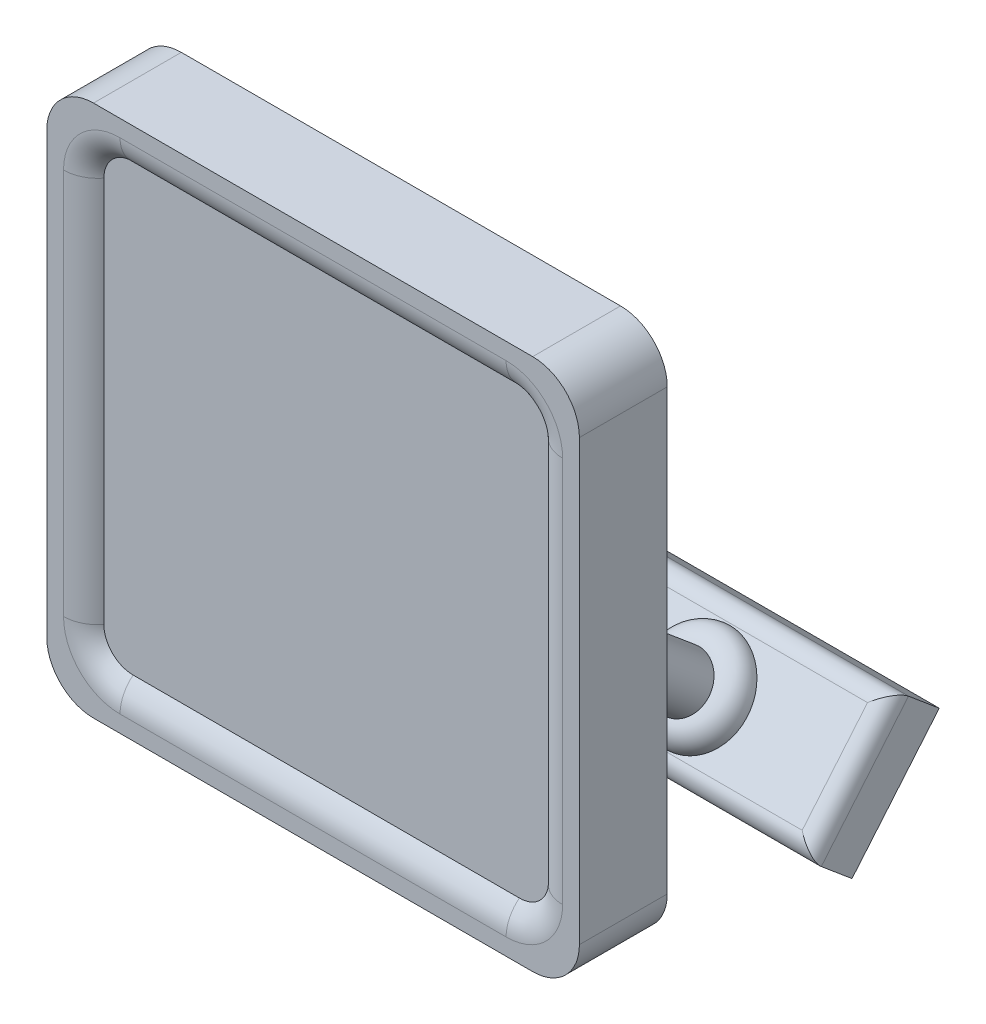
from build123d import *

# Parameters (mm, degrees)
BOSS_EXTRUDE1_DEPTH     = 25.4
CUT_EXTRUDE1_DEPTH      = 0.25399999999999945
CUT_EXTRUDE1_DEPTH_BACK = 3.8099999999999814
BOSS_EXTRUDE3_DEPTH     = 50.8
CUT_EXTRUDE3_DEPTH      = 38.1
SKETCH9_R               = 7.958201772862371
BOSS_EXTRUDE4_DEPTH     = 95.75799999999995
SKETCH11_W              = 88.91089611657237
SKETCH11_H              = 39.241441418777725
BOSS_EXTRUDE5_DEPTH     = 16.509999999999938
FILLET2_R               = 10
FILLET3_R               = 4.919999999999999


# Read off the part's stored shape, not the designer's step: Sweep1
with BuildPart() as part:
    # Sketch1 → Boss-Extrude1 (new body)
    with BuildSketch(Plane.XY):
        with BuildLine():
            Line((63.5, 77.01063829787236), (-63.5, 77.01063829787236))
            ThreePointArc((-63.5, 77.01063829787236), (-73.05346395858422, 73.05346395858422), (-77.01063829787236, 63.5))
            Line((-77.01063829787236, 63.5), (-77.01063829787236, -63.5))
            ThreePointArc((-77.01063829787236, -63.5), (-73.05346395858422, -73.05346395858422), (-63.5, -77.01063829787236))
            Line((-63.5, -77.01063829787236), (63.5, -77.01063829787236))
            ThreePointArc((63.5, -77.01063829787236), (73.05346395858422, -73.05346395858423), (77.01063829787236, -63.500000000000014))
            Line((77.01063829787236, -63.500000000000014), (77.01063829787236, 63.500000000000014))
            ThreePointArc((77.01063829787236, 63.500000000000014), (73.05346395858422, 73.05346395858423), (63.5, 77.01063829787236))
        make_face()
    extrude(amount=BOSS_EXTRUDE1_DEPTH)

    # Sketch3 → Cut-Extrude1 (cut, two sides: drawn at the far end of the back side and taken through both)
    with BuildSketch(Plane.XY.offset(25.4).offset(-CUT_EXTRUDE1_DEPTH_BACK)):
        with BuildLine():
            Line((-64.31063829787236, -55.89490495185724), (-64.31063829787236, 55.89490495185724))
            ThreePointArc((-64.31063829787236, 55.89490495185724), (-61.826342998624284, 61.86512188051967), (-55.84013695793273, 64.31063829787234))
            Line((-55.84013695793273, 64.31063829787234), (55.84013695793273, 64.31063829787234))
            ThreePointArc((55.84013695793273, 64.31063829787234), (61.826342998624284, 61.86512188051967), (64.31063829787236, 55.89490495185724))
            Line((64.31063829787236, 55.89490495185724), (64.31063829787236, -55.89490495185724))
            ThreePointArc((64.31063829787236, -55.89490495185724), (61.826342998624284, -61.86512188051967), (55.84013695793273, -64.31063829787234))
            Line((55.84013695793273, -64.31063829787234), (-55.84013695793273, -64.31063829787234))
            ThreePointArc((-55.84013695793273, -64.31063829787234), (-61.826342998624284, -61.86512188051967), (-64.31063829787236, -55.89490495185724))
        make_face()
    extrude(amount=CUT_EXTRUDE1_DEPTH + CUT_EXTRUDE1_DEPTH_BACK, mode=Mode.SUBTRACT)

    # Sketch7 → Boss-Extrude3 (add)
    with BuildSketch(Plane(origin=(0, 0, 0), x_dir=(-1, 0, 0), z_dir=(0, 0, -1))):
        with BuildLine():
            Line((-25.971736510678774, -77.01063829787236), (25.971736510678774, -77.0106382978723))
            Line((25.971736510678774, -77.0106382978723), (25.971736510678774, -33.11396405111534))
            ThreePointArc((25.971736510678774, -33.11396405111534), (-4.77e-15, -7.142227540436579), (-25.971736510678774, -33.11396405111537))
            Line((-25.971736510678774, -33.11396405111537), (-25.971736510678774, -77.01063829787236))
        make_face()
    extrude(amount=BOSS_EXTRUDE3_DEPTH)

    # Sketch8 → Cut-Extrude3 (cut)
    with BuildSketch(Plane(origin=(0, 0, -50.8), x_dir=(-1, 0, 0), z_dir=(0, 0, -1))):
        with BuildLine():
            Line((-10.388694604271498, -77.01063829787235), (-10.388694604271498, -31.815377225581233))
            ThreePointArc((-10.388694604271498, -31.815377225581233), (6.4e-16, -21.426682621309737), (10.388694604271498, -31.815377225581233))
            Line((10.388694604271498, -31.815377225581233), (10.388694604271498, -77.01063829787235))
            Line((10.388694604271498, -77.01063829787235), (-10.388694604271498, -77.01063829787235))
        make_face()
    extrude(amount=-CUT_EXTRUDE3_DEPTH, mode=Mode.SUBTRACT)

    # Sketch9 → Boss-Extrude4 (add)
    with BuildSketch(Plane(origin=(0, -19.311882184983943, -23.015004973711303), x_dir=(1, 0, 0), z_dir=(0, -0.6427876096865301, -0.7660444431189859))):
        with Locations(Location((0, 16.20859028637191, 0), (0, 0, 358.83868965))):
            Circle(SKETCH9_R)
    extrude(amount=BOSS_EXTRUDE4_DEPTH)



with BuildPart() as body_2:
    # Sketch11 → Boss-Extrude5 (new body)
    with BuildSketch(Plane(origin=(0, -80.86393811334668, -96.36988875789913), x_dir=(-1, 0, 0), z_dir=(0, -0.64278760968653, -0.766044443118986))):
        with Locations((0, -16.2085902863719)):
            Rectangle(SKETCH11_W, SKETCH11_H)
    extrude(amount=BOSS_EXTRUDE5_DEPTH)


with BuildPart() as part_1:
    add(part.part)

    add(body_2.part)  # Sweep1 merges body 2
    # Sweep1 outline → Sweep1 (revolve)
    with BuildSketch(Plane(origin=(0, -12.41650052, 10.418681007), x_dir=(1, 0, 0), z_dir=(0, -0.766044443118986, 0.64278760968653))):
        with BuildLine():
            ThreePointArc((14.308201773, -125.801955257), (12.448329834, -121.311827197), (7.958201773, -119.451955257))
            Line((7.958201773, -119.451955257), (7.958201773, -125.801955257))
            Line((7.958201773, -125.801955257), (14.308201773, -125.801955257))
        make_face()
    revolve(axis=Axis((0, -12.41650052, 10.418681007), (0, 0.64278760968653, 0.766044443118986)))

    # Fillet2
    # the kernel refuses this fillet: 10 mm, written as the material it takes off along each edge
    with BuildSketch(Plane(origin=(-55.894727894264214, 55.894904951857264, 25.4), x_dir=(-1, -2.53e-15, 0), z_dir=(2.53e-15, -1, 0))) as fillet2_piece_1:
        with BuildLine():
            CenterArc((16.269820257941824, 10), FILLET2_R, 218.24314589443497, 51.756854105565026)
            Line((8.415910403608144, 3.809999999999981), (8.258832206521468, 3.6861999999999817))
            ThreePointArc((8.258832206521468, 3.6861999999999817), (8.215910403608142, 1.9049999999999905), (8.215910403608142, 0))
            Line((8.215910403608142, 0), (8.415910403608144, -0.1999999999999993))
            Line((8.415910403608144, -0.1999999999999993), (16.269820257941824, -0.1999999999999993))
            Line((16.269820257941824, -0.1999999999999993), (16.269820257941824, 0))
        make_face()
    revolve(axis=Axis((-55.894727894264214, 55.894904951857264, 25.4), (0, 0, -1)), revolution_arc=90.37165939708579, mode=Mode.SUBTRACT)
    with BuildSketch(Plane(origin=(55.894727894264214, 55.894904951857264, 25.4), x_dir=(-0.00648663468518885, 0.9999789615639225, 0), z_dir=(-0.9999789615639225, -0.00648663468518885, 0))) as fillet2_piece_2:
        with BuildLine():
            CenterArc((16.269820257941824, 10), FILLET2_R, 218.24314589443495, 51.756854105565026)
            Line((8.415910403608141, 3.809999999999981), (8.258832206521465, 3.6861999999999817))
            ThreePointArc((8.258832206521465, 3.6861999999999817), (8.215910403608135, 1.9049999999999905), (8.215910403608135, 0))
            Line((8.215910403608135, 0), (8.415910403608141, -0.1999999999999993))
            Line((8.415910403608141, -0.1999999999999993), (16.269820257941824, -0.1999999999999993))
            Line((16.269820257941824, -0.1999999999999993), (16.269820257941824, 0))
        make_face()
    revolve(axis=Axis((55.894727894264214, 55.894904951857264, 25.4), (0, 0, -1)), revolution_arc=90.37165939708579, mode=Mode.SUBTRACT)
    with BuildSketch(Plane(origin=(64.31063829787236, -55.894904951857235, 25.4), x_dir=(1, 0, 0), z_dir=(0, 1, 0)), Plane(origin=(-64.31063829787236, 55.894904951857235, 25.4), x_dir=(-1, 0, 0), z_dir=(0, -1, 0))) as fillet2_piece_3:
        with BuildLine():
            CenterArc((7.853909854333679, 10), FILLET2_R, 218.24314589443497, 51.756854105565026)
            Line((0, 3.809999999999981), (-0.15707819708667614, 3.6861999999999817))
            ThreePointArc((-0.15707819708667614, 3.6861999999999817), (-0.20000000000000284, 1.9049999999999905), (-0.20000000000000284, 0))
            Line((-0.20000000000000284, 0), (0, -0.1999999999999993))
            Line((0, -0.1999999999999993), (7.853909854333679, -0.1999999999999993))
            Line((7.853909854333679, -0.1999999999999993), (7.853909854333679, 0))
        make_face()
    extrude(amount=111.78980990371448, mode=Mode.SUBTRACT)
    with BuildSketch(Plane(origin=(55.894727894264214, -55.894904951857264, 25.4), x_dir=(1, 2.53e-15, 0), z_dir=(-2.53e-15, 1, 0))) as fillet2_piece_4:
        with BuildLine():
            CenterArc((16.269820257941824, 10), FILLET2_R, 218.24314589443497, 51.756854105565026)
            Line((8.415910403608144, 3.809999999999981), (8.258832206521468, 3.6861999999999817))
            ThreePointArc((8.258832206521468, 3.6861999999999817), (8.215910403608142, 1.9049999999999905), (8.215910403608142, 0))
            Line((8.215910403608142, 0), (8.415910403608144, -0.1999999999999993))
            Line((8.415910403608144, -0.1999999999999993), (16.269820257941824, -0.1999999999999993))
            Line((16.269820257941824, -0.1999999999999993), (16.269820257941824, 0))
        make_face()
    revolve(axis=Axis((55.894727894264214, -55.894904951857264, 25.4), (0, 0, -1)), revolution_arc=90.37165939708579, mode=Mode.SUBTRACT)
    with BuildSketch(Plane(origin=(-55.840136957932735, -64.31063829787234, 25.4), x_dir=(0, -1, 0), z_dir=(1, 0, 0)), Plane(origin=(55.840136957932735, 64.31063829787234, 25.4), x_dir=(0, 1, 0), z_dir=(-1, 0, 0))) as fillet2_piece_5:
        with BuildLine():
            CenterArc((7.853909854333679, 10), FILLET2_R, 218.24314589443497, 51.756854105565026)
            Line((0, 3.809999999999981), (-0.15707819708667614, 3.6861999999999817))
            ThreePointArc((-0.15707819708667614, 3.6861999999999817), (-0.20000000000000284, 1.9049999999999905), (-0.20000000000000284, 0))
            Line((-0.20000000000000284, 0), (0, -0.1999999999999993))
            Line((0, -0.1999999999999993), (7.853909854333679, -0.1999999999999993))
            Line((7.853909854333679, -0.1999999999999993), (7.853909854333679, 0))
        make_face()
    extrude(amount=111.68027391586546, mode=Mode.SUBTRACT)
    with BuildSketch(Plane(origin=(-55.894727894264214, -55.894904951857264, 25.4), x_dir=(0.00648663468518885, -0.9999789615639225, 0), z_dir=(0.9999789615639225, 0.00648663468518885, 0))) as fillet2_piece_6:
        with BuildLine():
            CenterArc((16.269820257941824, 10), FILLET2_R, 218.24314589443495, 51.756854105565026)
            Line((8.415910403608141, 3.809999999999981), (8.258832206521465, 3.6861999999999817))
            ThreePointArc((8.258832206521465, 3.6861999999999817), (8.215910403608135, 1.9049999999999905), (8.215910403608135, 0))
            Line((8.215910403608135, 0), (8.415910403608141, -0.1999999999999993))
            Line((8.415910403608141, -0.1999999999999993), (16.269820257941824, -0.1999999999999993))
            Line((16.269820257941824, -0.1999999999999993), (16.269820257941824, 0))
        make_face()
    revolve(axis=Axis((-55.894727894264214, -55.894904951857264, 25.4), (0, 0, -1)), revolution_arc=90.37165939708579, mode=Mode.SUBTRACT)

    # Fillet3
    fillet3_edges = [part_1.edges().sort_by_distance(p)[0] for p in [
        (-44.45544805828619, -93.28043863301424, -85.95120775133383),
        (0, -78.2500945635973, -98.5631639164489),
        (44.45544805828619, -93.28043863301424, -85.95120775133383),
        (0, -108.3107827024312, -73.33925158621877),
    ]]
    fillet(fillet3_edges, radius=FILLET3_R)


solid = part_1.part
